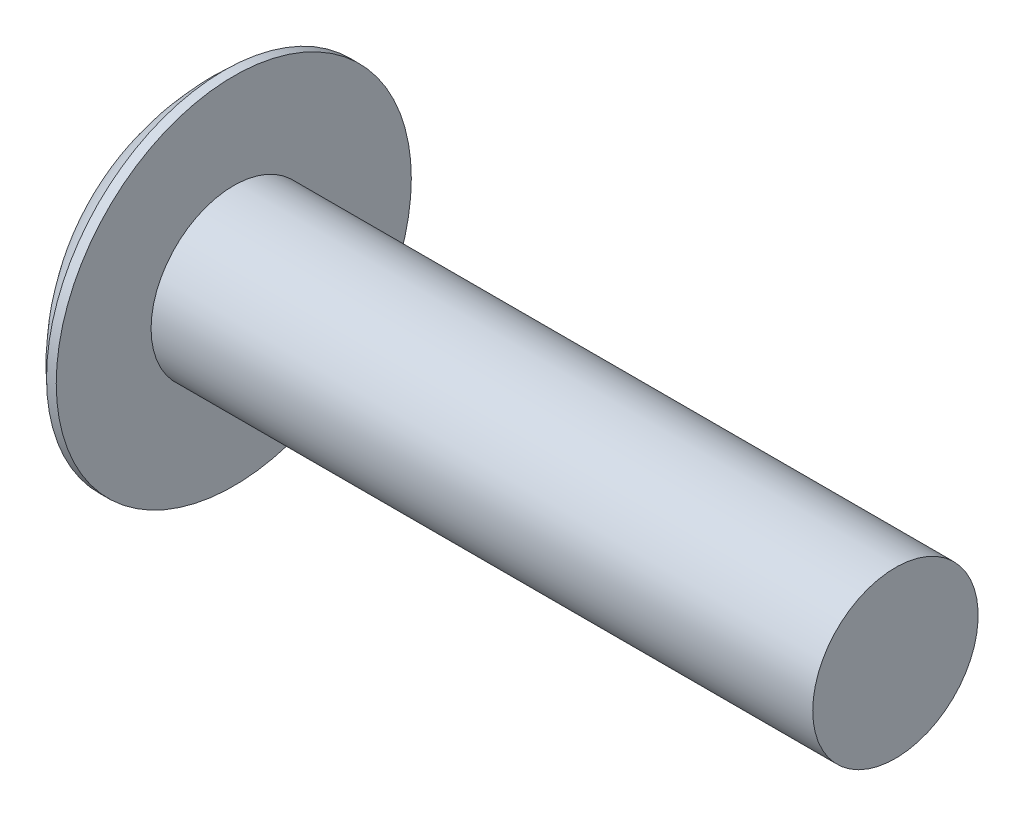
from build123d import *

# Parameters (mm, degrees)
SKETCH2_W         = 20.447
SKETCH2_H         = 2.2098
SLOT_DEPTH        = 2.8448
CIRPATTERN1_COUNT = 2
CIRPATTERN1_ANGLE = 90


with BuildPart() as part:
    # BodySke → Base-Revolve (revolve)
    with BuildSketch(Plane.XY):
        with BuildLine():
            Line((5.1562, 4.7625), (5.1562, 10.2235))
            Line((5.1562, 10.2235), (4.597800219, 10.2235))
            ThreePointArc((4.597800219, 10.2235), (1.202344739, 5.604902299), (0, 0))
            Line((0, 0), (43.2562, 0))
            Line((43.2562, 0), (43.2562, 4.7625))
            Line((43.2562, 4.7625), (5.1562, 4.7625))
        make_face()
    revolve(axis=Axis((-25.4, 0, 0), (1, 0, 0)))

    # Sketch2 → Slot (cut)
    with BuildSketch(Plane(origin=(0, 0, 0), x_dir=(0, 0, -1), z_dir=(1, 0, 0))):
        Rectangle(SKETCH2_W, SKETCH2_H)
    extrude(amount=SLOT_DEPTH, mode=Mode.SUBTRACT)

    # Sketch3 → Cross section 0
    with BuildSketch(Plane(origin=(0, 0, 0), x_dir=(0, 0, -1), z_dir=(1, 0, 0))):
        with BuildLine():
            Line((1.2319, -7.4676), (-1.2319, -7.4676))
            Line((-1.2319, -7.4676), (-1.2319, 7.4676))
            Line((-1.2319, 7.4676), (1.2319, 7.4676))
            Line((1.2319, 7.4676), (1.2319, -7.4676))
        make_face()
    # Sketch4 → Cross section 1
    with BuildSketch(Plane(origin=(8.9916, 0, 0), x_dir=(0, 0, -1), z_dir=(1, 0, 0))):
        with BuildLine():
            Line((0.61595, -0.61595), (-0.61595, -0.61595))
            Line((-0.61595, -0.61595), (-0.61595, 0.61595))
            Line((-0.61595, 0.61595), (0.61595, 0.61595))
            Line((0.61595, 0.61595), (0.61595, -0.61595))
        make_face()
    cross = loft(mode=Mode.SUBTRACT)

    # CirPattern1: Cross ×2 about axis
    cirpattern1_axis = Axis((-25.4, 0, 0), (1, 0, 0))
    for i in range(1, CIRPATTERN1_COUNT):
        add(cross.rotate(cirpattern1_axis, i * CIRPATTERN1_ANGLE / (CIRPATTERN1_COUNT - 1)), mode=Mode.SUBTRACT)


solid = part.part
